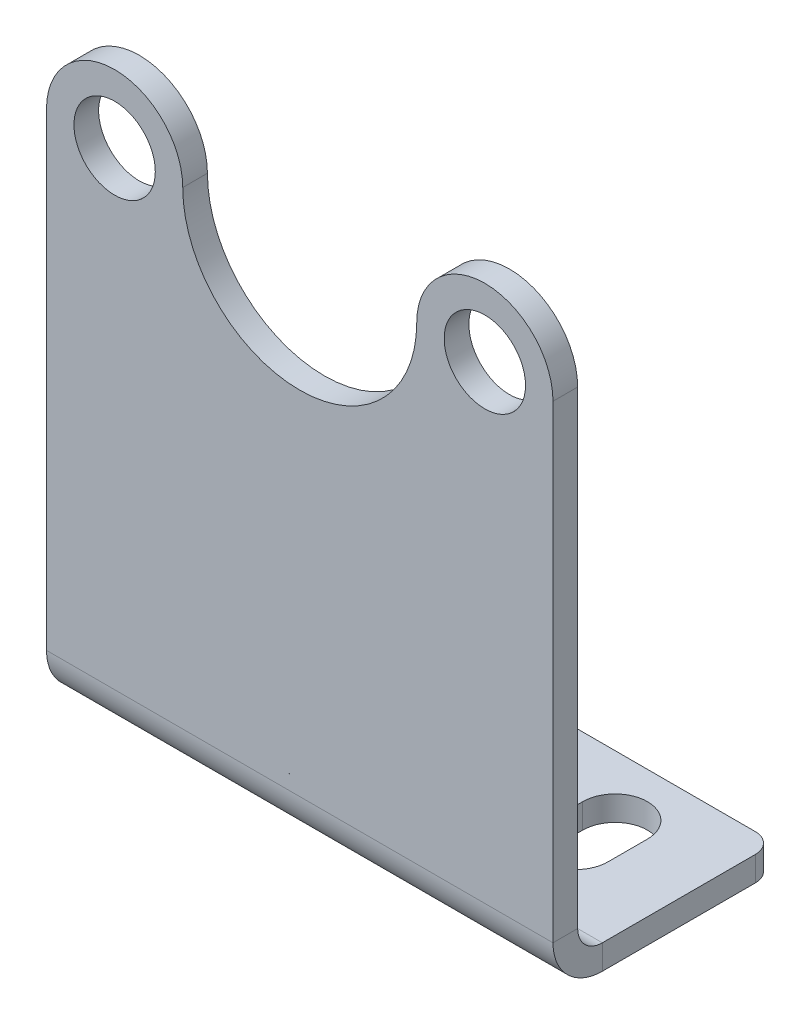
from build123d import *

# Parameters (mm, degrees)
SKETCH1_R              = 5.2324
BOSS_EXTRUDE1_DEPTH    = 3.175
SKETCH2_W              = 65.151
SKETCH2_H              = 3.175
BOSS_EXTRUDE2_DEPTH    = 25.4
FILLET1_R              = 2.54
CUT_EXTRUDE1_DEPTH     = 3.175
CONVERT_SOLID1_START   = -32.6263
CONVERT_SOLID1_DEPTH   = 65.151
CONVERT_SOLID1_2_DEPTH = 65.151


# Read off the part's stored shape, not the designer's step: Convert-Solid1
with BuildPart() as part:
    # Sketch1 → Boss-Extrude1 (new body)
    with BuildSketch(Plane.XY):
        with BuildLine():
            Line((32.5247, -81.185268118), (32.5247, -14.510268118))
            ThreePointArc((32.5247, -14.510268118), (23.7617, -5.747268118), (14.9987, -14.510268118))
            ThreePointArc((14.9987, -14.510268118), (-0.0508, -29.559768118), (-15.1003, -14.510268118))
            ThreePointArc((-15.1003, -14.510268118), (-23.8633, -5.747268118), (-32.6263, -14.510268118))
            Line((-32.6263, -14.510268118), (-32.6263, -81.185268118))
            Line((-32.6263, -81.185268118), (32.5247, -81.185268118))
        make_face()
        with Locations((-23.8633, -14.510268118)):
            Circle(SKETCH1_R, mode=Mode.SUBTRACT)
        with Locations((23.7617, -14.510268118)):
            Circle(SKETCH1_R, mode=Mode.SUBTRACT)
    extrude(amount=BOSS_EXTRUDE1_DEPTH)

    # Sketch2 → Boss-Extrude2 (add)
    with BuildSketch(Plane(origin=(0, 0, 0), x_dir=(-1, 0, 0), z_dir=(0, 0, -1))):
        with Locations((0.0508, -79.597768118)):
            Rectangle(SKETCH2_W, SKETCH2_H)
    extrude(amount=BOSS_EXTRUDE2_DEPTH)

    # Fillet1
    fillet1_edges = [part.edges().sort_by_distance(p)[0] for p in [
        (32.5247, -79.597768118, -25.4),
        (-32.6263, -79.597768118, -25.4),
    ]]
    fillet(fillet1_edges, radius=FILLET1_R)

    # Sketch3 → Cut-Extrude1 (cut)
    with BuildSketch(Plane(origin=(0, -78.010268118, 0), x_dir=(1, 0, 0), z_dir=(0, 1, 0))):
        with BuildLine():
            Line((15.538165915, 12.554273752), (15.538165915, 17.634273752))
            ThreePointArc((15.538165915, 17.634273752), (19.705353415, 21.801461252), (23.872540915, 17.634273752))
            Line((23.872540915, 17.634273752), (23.872540915, 12.554273752))
            ThreePointArc((23.872540915, 12.554273752), (19.705353415, 8.387086252), (15.538165915, 12.554273752))
        make_face()
        with BuildLine():
            Line((-24.461834085, 12.554273752), (-24.461834085, 17.634273752))
            ThreePointArc((-24.461834085, 17.634273752), (-20.294646585, 21.801461252), (-16.127459085, 17.634273752))
            Line((-16.127459085, 17.634273752), (-16.127459085, 12.554273752))
            ThreePointArc((-16.127459085, 12.554273752), (-20.294646585, 8.387086252), (-24.461834085, 12.554273752))
        make_face()
    extrude(amount=-CUT_EXTRUDE1_DEPTH, mode=Mode.SUBTRACT)

    # Convert-Solid1 outline → Convert-Solid1 (cut)
    with BuildSketch(Plane.YZ.offset(CONVERT_SOLID1_START)):
        with BuildLine():
            Line((-81.185268118, 3.175), (-81.185268118, -3.175))
            ThreePointArc((-81.185268118, -3.175), (-79.325396179, 1.315128061), (-74.835268118, 3.175))
            Line((-74.835268118, 3.175), (-81.185268118, 3.175))
        make_face()
    extrude(amount=CONVERT_SOLID1_DEPTH, mode=Mode.SUBTRACT)

    # Convert-Solid1 2 outline → Convert-Solid1 2 (add)
    with BuildSketch(Plane.YZ.offset(CONVERT_SOLID1_START)):
        with BuildLine():
            Line((-78.010268118, 0), (-78.010268118, -3.175))
            ThreePointArc((-78.010268118, -3.175), (-77.080332148, -0.92993597), (-74.835268118, 0))
            Line((-74.835268118, 0), (-78.010268118, 0))
        make_face()
    extrude(amount=CONVERT_SOLID1_2_DEPTH)


solid = part.part
